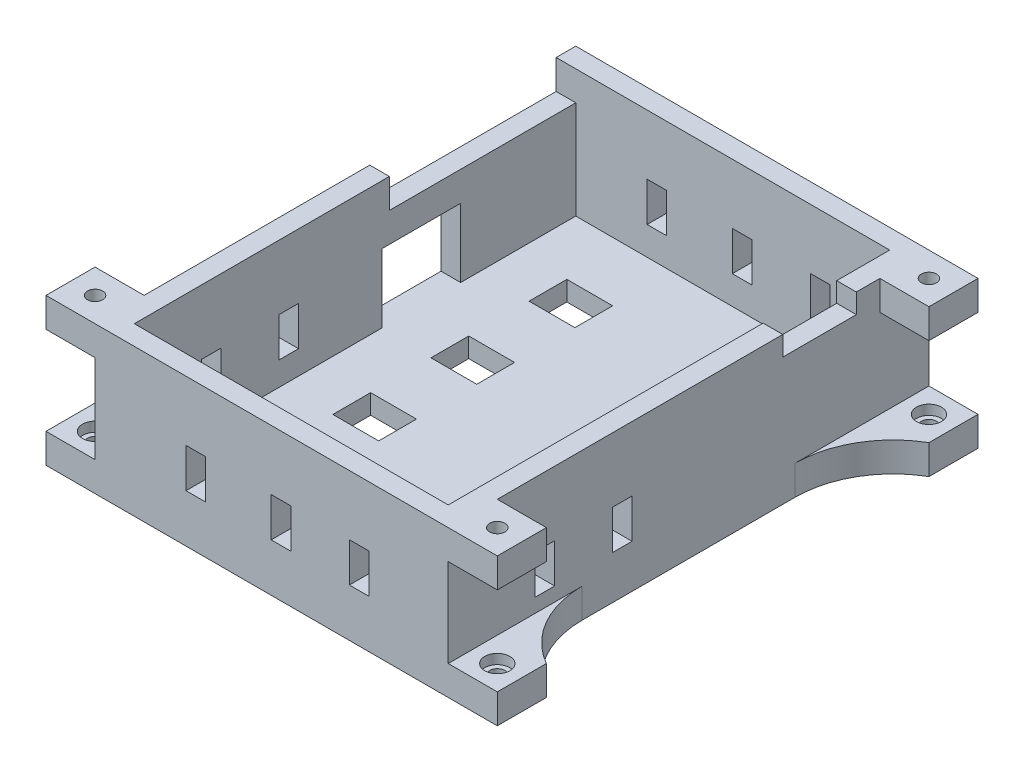
from build123d import *

# Parameters (mm, degrees)
SKETCH1_W               = 36
SKETCH1_H               = 49
BOSS_EXTRUDE1_DEPTH     = 2
SKETCH2_W               = 36
SKETCH2_H               = 49
SKETCH2_W_2             = 32
SKETCH2_H_2             = 45
BOSS_EXTRUDE2_DEPTH     = 13
CUT_EXTRUDE1_DEPTH      = 5
CUT_EXTRUDE1_DEPTH_BACK = 48.529259103
SKETCH3_W               = 7.5
SKETCH3_H               = 2
SKETCH4_W               = 4.670437484
SKETCH4_H               = 3.853110924
CUT_EXTRUDE2_DEPTH      = 41.051989913
SKETCH10_W              = 2
SKETCH10_H              = 19
CUT_EXTRUDE6_DEPTH      = 3
SKETCH11_W              = 8
SKETCH11_H              = 7
CUT_EXTRUDE7_DEPTH      = 2
SKETCH12_W              = 5
SKETCH12_H              = 3
BOSS_EXTRUDE3_DEPTH     = 5
SKETCH13_W              = 5
SKETCH13_H              = 3
BOSS_EXTRUDE4_DEPTH     = 5
SKETCH14_R              = 0.775
CUT_EXTRUDE8_DEPTH      = 44.046736753
SKETCH15_R              = 1.275
CUT_EXTRUDE9_DEPTH      = 1
CUT_EXTRUDE10_START     = -1
SKETCH16_R              = 1.275
CUT_EXTRUDE10_DEPTH     = 1
FILLET2_R               = 10
SKETCH17_W              = 2
SKETCH17_H              = 4
CUT_EXTRUDE11_DEPTH     = 59.103279375
SKETCH18_W              = 2
SKETCH18_H              = 4
CUT_EXTRUDE12_DEPTH     = 53.763912582
SKETCH19_W              = 37.08283529
SKETCH19_H              = 2
CUT_EXTRUDE13_DEPTH     = 2
SKETCH20_W              = 37.08283529
SKETCH20_H              = 2
BOSS_EXTRUDE5_DEPTH     = 2
SKETCH21_W              = 2
SKETCH21_H              = 28
CUT_EXTRUDE14_DEPTH     = 2
SKETCH22_W              = 2
SKETCH22_H              = 28
BOSS_EXTRUDE6_DEPTH     = 2
SKETCH23_W              = 2
SKETCH23_H              = 34.1
CUT_EXTRUDE16_DEPTH     = 1.5
SKETCH24_W              = 2
SKETCH24_H              = 34.1
BOSS_EXTRUDE7_DEPTH     = 1.5


with BuildPart() as part:
    # Sketch1 → Boss-Extrude1 (new body)
    with BuildSketch(Plane(origin=(0, 0, 0), x_dir=(1, 0, 0), z_dir=(0, 1, 0))):
        with Locations((4.385964912, -5.131578947)):
            Rectangle(SKETCH1_W, SKETCH1_H)
    extrude(amount=BOSS_EXTRUDE1_DEPTH)

    # Sketch2 → Boss-Extrude2 (add)
    with BuildSketch(Plane(origin=(0, 2, 0), x_dir=(1, 0, 0), z_dir=(0, 1, 0))):
        with Locations((4.385964912, -5.131578947)):
            Rectangle(SKETCH2_W, SKETCH2_H)
        with Locations((4.385964912, -5.131578947)):
            Rectangle(SKETCH2_W_2, SKETCH2_H_2, mode=Mode.SUBTRACT)
    extrude(amount=BOSS_EXTRUDE2_DEPTH)

    # Sketch3 → Cut-Extrude1 (cut, two sides: drawn at the far end of the back side and taken through both)
    with BuildSketch(Plane.ZY.offset(-20.385964912).offset(-CUT_EXTRUDE1_DEPTH_BACK)):
        with Locations((-8.218421053, 14)):
            Rectangle(SKETCH3_W, SKETCH3_H)
    extrude(amount=CUT_EXTRUDE1_DEPTH + CUT_EXTRUDE1_DEPTH_BACK, mode=Mode.SUBTRACT)

    # Sketch4 → Cut-Extrude2 (cut, through all)
    with BuildSketch(Plane.XZ):
        with Locations((11.852478182, 20.598290589)):
            Rectangle(SKETCH4_W, SKETCH4_H)
        with Locations((-4.147521818, 20.598290589)):
            Rectangle(SKETCH4_W, SKETCH4_H)
        with Locations((11.852478182, 10.598290589)):
            Rectangle(SKETCH4_W, SKETCH4_H)
        with Locations((11.852478182, 0.598290589)):
            Rectangle(SKETCH4_W, SKETCH4_H)
        with Locations((11.852478182, -9.401709411)):
            Rectangle(SKETCH4_W, SKETCH4_H)
        with Locations((-4.147521818, 10.598290589)):
            Rectangle(SKETCH4_W, SKETCH4_H)
        with Locations((-4.147521818, 0.598290589)):
            Rectangle(SKETCH4_W, SKETCH4_H)
        with Locations((-4.147521818, -9.401709411)):
            Rectangle(SKETCH4_W, SKETCH4_H)
    extrude(amount=-CUT_EXTRUDE2_DEPTH, mode=Mode.SUBTRACT)

    # Sketch10 → Cut-Extrude6 (cut)
    with BuildSketch(Plane(origin=(0, 15, 0), x_dir=(1, 0, 0), z_dir=(0, 1, 0))):
        with Locations((-12.614035088, 7.868421053)):
            Rectangle(SKETCH10_W, SKETCH10_H)
    extrude(amount=-CUT_EXTRUDE6_DEPTH, mode=Mode.SUBTRACT)

    # Sketch11 → Cut-Extrude7 (cut)
    with BuildSketch(Plane.ZY.offset(13.614035088)):
        with Locations((-1.634350226, 5.5)):
            Rectangle(SKETCH11_W, SKETCH11_H)
    extrude(amount=-CUT_EXTRUDE7_DEPTH, mode=Mode.SUBTRACT)

    # Sketch12 → Boss-Extrude3 (add)
    with BuildSketch(Plane.ZY.offset(13.614035088)):
        with Locations((-16.868421053, 1.5)):
            Rectangle(SKETCH12_W, SKETCH12_H)
        with Locations((27.131578947, 13.5)):
            Rectangle(SKETCH12_W, SKETCH12_H)
        with Locations((27.131578947, 1.5)):
            Rectangle(SKETCH12_W, SKETCH12_H)
    extrude(amount=BOSS_EXTRUDE3_DEPTH)

    # Sketch13 → Boss-Extrude4 (add)
    with BuildSketch(Plane(origin=(22.385964912, 0, 0), x_dir=(0, 0, -1), z_dir=(1, 0, 0))):
        with Locations((16.868421053, 1.5)):
            Rectangle(SKETCH13_W, SKETCH13_H)
        with Locations((-27.131578947, 13.5)):
            Rectangle(SKETCH13_W, SKETCH13_H)
        with Locations((-27.131578947, 1.5)):
            Rectangle(SKETCH13_W, SKETCH13_H)
        with Locations((16.868421053, 13.5)):
            Rectangle(SKETCH13_W, SKETCH13_H)
    extrude(amount=BOSS_EXTRUDE4_DEPTH)

    # Sketch14 → Cut-Extrude8 (cut, through all)
    with BuildSketch(Plane.XZ):
        with Locations(Location((24.885964912, -16.868421053, 0), (0, 0, 270))):
            Circle(SKETCH14_R)
        with Locations(Location((-16.114035088, -16.868421053, 0), (0, 0, 270))):
            Circle(SKETCH14_R)
        with Locations(Location((-16.114035088, 27.131578947, 0), (0, 0, 270))):
            Circle(SKETCH14_R)
        with Locations(Location((24.885964912, 27.131578947, 0), (0, 0, 270))):
            Circle(SKETCH14_R)
    extrude(amount=-CUT_EXTRUDE8_DEPTH, mode=Mode.SUBTRACT)

    # Sketch15 → Cut-Extrude9 (cut)
    with BuildSketch(Plane(origin=(0, 3, 0), x_dir=(1, 0, 0), z_dir=(0, 1, 0))):
        with Locations(Location((24.885964912, 16.868421053, 0), (0, 0, 270))):
            Circle(SKETCH15_R)
        with Locations(Location((24.885964912, -27.131578947, 0), (0, 0, 270))):
            Circle(SKETCH15_R)
        with Locations(Location((-16.114035088, -27.131578947, 0), (0, 0, 270))):
            Circle(SKETCH15_R)
        with Locations(Location((-16.114035088, 16.868421053, 0), (0, 0, 270))):
            Circle(SKETCH15_R)
    extrude(amount=-CUT_EXTRUDE9_DEPTH, mode=Mode.SUBTRACT)

    # Sketch16 → Cut-Extrude10 (cut)
    with BuildSketch(Plane.XZ.offset(-12).offset(CUT_EXTRUDE10_START)):
        with Locations(Location((-16.114035088, 27.131578947, 0), (0, 0, 90))):
            Circle(SKETCH16_R)
        with Locations(Location((24.885964912, 27.131578947, 0), (0, 0, 90))):
            Circle(SKETCH16_R)
        with Locations(Location((24.885964912, -16.868421053, 0), (0, 0, 90))):
            Circle(SKETCH16_R)
    extrude(amount=CUT_EXTRUDE10_DEPTH, mode=Mode.SUBTRACT)

    # Fillet2
    # the kernel refuses this fillet: 10 mm, written as the material it adds along each edge
    with BuildSketch(Plane(origin=(-13.614035088, 0, -14.368421053), x_dir=(0, 0, 1), z_dir=(0, 1, 0)), Plane(origin=(22.385964912, 0, 24.631578947), x_dir=(0, 0, -1), z_dir=(0, 1, 0))) as fillet2_piece_1:
        with BuildLine():
            CenterArc((8.660254038, -10), FILLET2_R, 90, 60)
            Line((0, -5), (0, 0))
            Line((0, 0), (8.660254038, 0))
        make_face()
    extrude(amount=3)
    with BuildSketch(Plane(origin=(22.385964912, 0, -14.368421053), x_dir=(0, 0, 1), z_dir=(0, 1, 0)), Plane(origin=(-13.614035088, 0, 24.631578947), x_dir=(0, 0, -1), z_dir=(0, 1, 0))) as fillet2_piece_2:
        with BuildLine():
            CenterArc((8.660254038, 10), FILLET2_R, 210, 60)
            Line((0, 5), (0, 0))
            Line((0, 0), (8.660254038, 0))
        make_face()
    extrude(amount=3)

    # Sketch17 → Cut-Extrude11 (cut, through all)
    with BuildSketch(Plane.XY.offset(29.631578947)):
        with Locations((-3.340209091, 6.894489406)):
            Rectangle(SKETCH17_W, SKETCH17_H)
        with Locations((5.343190897, 6.894489406)):
            Rectangle(SKETCH17_W, SKETCH17_H)
        with Locations((13.309543319, 6.894489406)):
            Rectangle(SKETCH17_W, SKETCH17_H)
    extrude(amount=-CUT_EXTRUDE11_DEPTH, mode=Mode.SUBTRACT)

    # Sketch18 → Cut-Extrude12 (cut, through all)
    with BuildSketch(Plane.ZY.offset(13.614035088)):
        with Locations((11.893757697, 6.4242408)):
            Rectangle(SKETCH18_W, SKETCH18_H)
        with Locations((19.784308777, 6.4242408)):
            Rectangle(SKETCH18_W, SKETCH18_H)
    extrude(amount=-CUT_EXTRUDE12_DEPTH, mode=Mode.SUBTRACT)

    # Sketch19 → Cut-Extrude13 (cut)
    with BuildSketch(Plane(origin=(0, 15, 0), x_dir=(1, 0, 0), z_dir=(0, 1, 0))):
        with Locations((4.927382557, 18.368421053)):
            Rectangle(SKETCH19_W, SKETCH19_H)
    extrude(amount=-CUT_EXTRUDE13_DEPTH, mode=Mode.SUBTRACT)

    # Sketch20 → Boss-Extrude5 (add)
    with BuildSketch(Plane(origin=(0, 13, 0), x_dir=(1, 0, 0), z_dir=(0, 1, 0))):
        with Locations((4.927382557, 18.368421053)):
            Rectangle(SKETCH20_W, SKETCH20_H)
    extrude(amount=BOSS_EXTRUDE5_DEPTH)

    # Sketch21 → Cut-Extrude14 (cut)
    with BuildSketch(Plane(origin=(0, 15, 0), x_dir=(1, 0, 0), z_dir=(0, 1, 0))):
        with Locations((-12.614035088, -15.631578947)):
            Rectangle(SKETCH21_W, SKETCH21_H)
    extrude(amount=-CUT_EXTRUDE14_DEPTH, mode=Mode.SUBTRACT)

    # Sketch22 → Boss-Extrude6 (add)
    with BuildSketch(Plane(origin=(0, 13, 0), x_dir=(1, 0, 0), z_dir=(0, 1, 0))):
        with Locations((-12.614035088, -15.631578947)):
            Rectangle(SKETCH22_W, SKETCH22_H)
    extrude(amount=BOSS_EXTRUDE6_DEPTH)

    # Sketch23 → Cut-Extrude16 (cut)
    with BuildSketch(Plane(origin=(0, 15, 0), x_dir=(1, 0, 0), z_dir=(0, 1, 0))):
        with Locations((21.385964912, -12.581578947)):
            Rectangle(SKETCH23_W, SKETCH23_H)
    extrude(amount=-CUT_EXTRUDE16_DEPTH, mode=Mode.SUBTRACT)

    # Sketch24 → Boss-Extrude7 (add)
    with BuildSketch(Plane(origin=(0, 13.5, 0), x_dir=(1, 0, 0), z_dir=(0, 1, 0))):
        with Locations((21.385964912, -12.581578947)):
            Rectangle(SKETCH24_W, SKETCH24_H)
    extrude(amount=BOSS_EXTRUDE7_DEPTH)


solid = part.part
